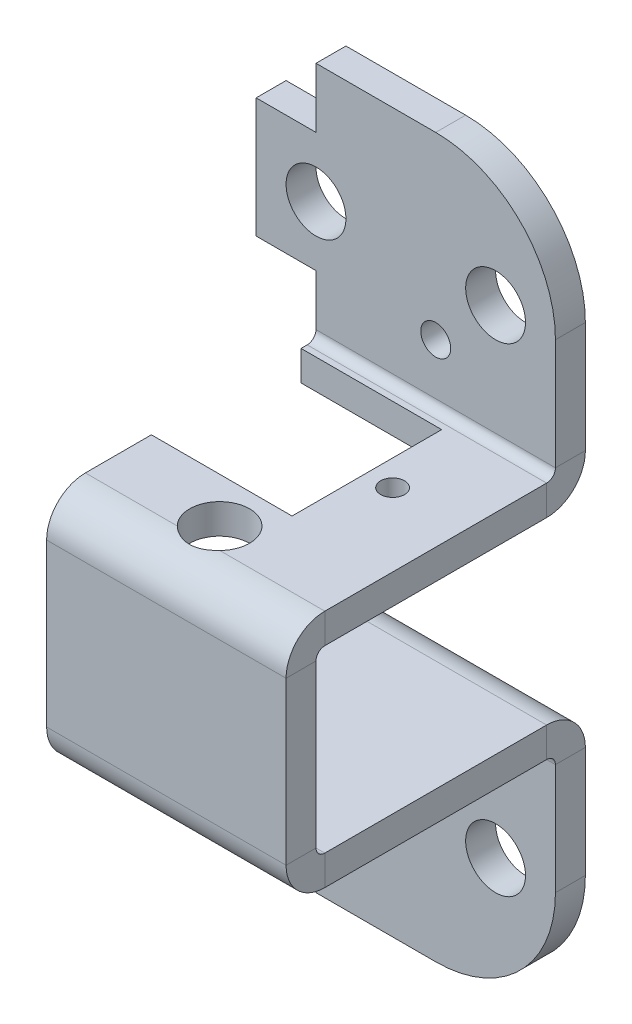
from build123d import *

# Parameters (mm, degrees)
SKETCH1_W           = 40
SKETCH1_H           = 60
SKETCH1_R           = 1.25
BASE_FLANGE1_DEPTH  = 2.5
SKETCH15_R          = 1
CUT_EXTRUDE3_DEPTH  = 10
JOG3_START          = -2.5
JOG3_OUTLINE_W      = 40
JOG3_OUTLINE_H      = 58.294687966
JOG3_OUTLINE_R      = 1
JOG3_OUTLINE_R_2    = 1.25
JOG3_DEPTH          = 2.5
JOG3_2_OUTLINE_W    = 40
JOG3_2_OUTLINE_H    = 1.705312034
JOG3_2_DEPTH        = 0.332528284
JOG3_START_2        = 19.2634
JOG3_3_OUTLINE_W    = 40
JOG3_3_OUTLINE_H    = 40
JOG3_3_OUTLINE_R    = 1
JOG3_3_OUTLINE_R_2  = 1.25
JOG3_3_DEPTH        = 3.2366
JOG3_4_OUTLINE_W    = 40
JOG3_4_OUTLINE_H    = 20.794687966
JOG3_4_OUTLINE_R    = 1.25
JOG3_4_DEPTH        = 3.2366
JOG3_5_OUTLINE_W    = 40
JOG3_5_OUTLINE_H    = 2.5
JOG3_5_DEPTH        = 20
JOG3_START_3        = 20
JOG3_6_OUTLINE_R    = 1.25
JOG3_6_OUTLINE_R_2  = 1
JOG3_6_DEPTH        = 2.5
JOG3_START_4        = -20
JOG3_7_DEPTH        = 40
JOG4_START          = -20
JOG4_DEPTH          = 40
JOG4_2_DEPTH        = 40
JOG4_START_2        = -3
JOG4_3_OUTLINE_R    = 1.25
JOG4_3_DEPTH        = 4
FILLET1_R           = 10
SKETCH18_R          = 2.5
BOSS_EXTRUDE1_DEPTH = 2.5
SKETCH19_R          = 1
SKETCH19_W          = 23.5
SKETCH19_H          = 12.5
CUT_EXTRUDE4_DEPTH  = 2.5
SKETCH20_R          = 2.5
CUT_EXTRUDE6_DEPTH  = 10
SKETCH23_R          = 2.5
CUT_EXTRUDE7_DEPTH  = 51.062460986
SKETCH24_R          = 5
CUT_EXTRUDE8_DEPTH  = 1.25
SKETCH26_R          = 2.5
CUT_EXTRUDE12_DEPTH = 51.062460987
SKETCH27_W          = 20
SKETCH27_H          = 13.5268
CUT_EXTRUDE13_DEPTH = 61.042487703


with BuildPart() as part:
    # Base-Flange1: sheet metal written as solids
    # Sketch1 → Base-Flange1 (new body)
    with BuildSketch(Plane.XY):
        Rectangle(SKETCH1_W, SKETCH1_H)
        with Locations((10, 15)):
            Circle(SKETCH1_R, mode=Mode.SUBTRACT)
        with Locations(Location((10, -15, 0), (0, 0, 180))):
            Circle(SKETCH1_R, mode=Mode.SUBTRACT)
        with Locations((-10, -15)):
            Circle(SKETCH1_R, mode=Mode.SUBTRACT)
        with Locations(Location((-10, 15, 0), (0, 0, 180))):
            Circle(SKETCH1_R, mode=Mode.SUBTRACT)
    extrude(amount=-BASE_FLANGE1_DEPTH)

    # Sketch15 → Cut-Extrude3 (cut)
    with BuildSketch(Plane.XY):
        with Locations((12, 0)):
            Circle(SKETCH15_R)
        with Locations(Location((-17, 0, 0), (0, 0, 180))):
            Circle(SKETCH15_R)
    extrude(amount=-CUT_EXTRUDE3_DEPTH, mode=Mode.SUBTRACT)

    # Jog3: read off the stored shape, not the designer's step
    # Jog3 outline → Jog3 (cut)
    with BuildSketch(Plane.XY.offset(JOG3_START)):
        with Locations((0, -0.852656017)):
            Rectangle(JOG3_OUTLINE_W, JOG3_OUTLINE_H)
        with Locations((-17, 0)):
            Circle(JOG3_OUTLINE_R, mode=Mode.SUBTRACT)
        with Locations((12, 0)):
            Circle(JOG3_OUTLINE_R, mode=Mode.SUBTRACT)
        with Locations((-10, 15)):
            Circle(JOG3_OUTLINE_R_2, mode=Mode.SUBTRACT)
        with Locations((10, 15)):
            Circle(JOG3_OUTLINE_R_2, mode=Mode.SUBTRACT)
        with Locations((10, -15)):
            Circle(JOG3_OUTLINE_R_2, mode=Mode.SUBTRACT)
        with Locations((-10, -15)):
            Circle(JOG3_OUTLINE_R_2, mode=Mode.SUBTRACT)
    extrude(amount=JOG3_DEPTH, mode=Mode.SUBTRACT)

    # Jog3 2 outline → Jog3 2 (cut)
    with BuildSketch(Plane.XY.offset(JOG3_START)):
        with Locations((0, 29.147343983)):
            Rectangle(JOG3_2_OUTLINE_W, JOG3_2_OUTLINE_H)
    extrude(amount=JOG3_2_DEPTH, mode=Mode.SUBTRACT)

    # Jog3 4 outline → Jog3 4 (add)
    with BuildSketch(Plane.XY.offset(JOG3_START)):
        with Locations((0, 40.397343983)):
            Rectangle(JOG3_4_OUTLINE_W, JOG3_4_OUTLINE_H)
        with Locations((10, 35.794687966)):
            Circle(JOG3_4_OUTLINE_R, mode=Mode.SUBTRACT)
        with Locations((-10, 35.794687966)):
            Circle(JOG3_4_OUTLINE_R, mode=Mode.SUBTRACT)
    extrude(amount=JOG3_4_DEPTH)



with BuildPart() as body_2:
    # Jog3 3 outline → Jog3 3 (new body)
    with BuildSketch(Plane.XY.offset(JOG3_START_2)):
        with Locations((0, 10.794687966)):
            Rectangle(JOG3_3_OUTLINE_W, JOG3_3_OUTLINE_H)
        with Locations((12, 20.794687966)):
            Circle(JOG3_3_OUTLINE_R, mode=Mode.SUBTRACT)
        with Locations((-17, 0)):
            Circle(JOG3_3_OUTLINE_R, mode=Mode.SUBTRACT)
        with Locations((-10, 5.794687966)):
            Circle(JOG3_3_OUTLINE_R_2, mode=Mode.SUBTRACT)
        with Locations((12, 0)):
            Circle(JOG3_3_OUTLINE_R, mode=Mode.SUBTRACT)
        with Locations((10, 5.794687966)):
            Circle(JOG3_3_OUTLINE_R_2, mode=Mode.SUBTRACT)
        with Locations((-17, 20.794687966)):
            Circle(JOG3_3_OUTLINE_R, mode=Mode.SUBTRACT)
        with Locations((-10, 15)):
            Circle(JOG3_3_OUTLINE_R_2, mode=Mode.SUBTRACT)
        with Locations((10, 15)):
            Circle(JOG3_3_OUTLINE_R_2, mode=Mode.SUBTRACT)
    extrude(amount=JOG3_3_DEPTH)


with BuildPart() as part_1:
    add(part.part)

    add(body_2.part)  # Jog3 5 merges body 2
    # Jog3 5 outline → Jog3 5 (add)
    with BuildSketch(Plane.XY):
        with Locations((0, 29.544687966)):
            Rectangle(JOG3_5_OUTLINE_W, JOG3_5_OUTLINE_H)
    extrude(amount=JOG3_5_DEPTH)

    # Jog3 6 outline → Jog3 6 (add)
    with BuildSketch(Plane.XY.offset(JOG3_START_3)):
        with Locations((10, 15)):
            Circle(JOG3_6_OUTLINE_R)
        with Locations((-10, 15)):
            Circle(JOG3_6_OUTLINE_R)
        with Locations((12, 0)):
            Circle(JOG3_6_OUTLINE_R_2)
        with Locations((-17, 0)):
            Circle(JOG3_6_OUTLINE_R_2)
    extrude(amount=JOG3_6_DEPTH)

    # Jog3 7 outline → Jog3 7 (cut)
    with BuildSketch(Plane.YZ.offset(JOG3_START_4)):
        with BuildLine():
            ThreePointArc((28.294687966, 19.2634), (28.078942821, 19.784254855), (27.558087966, 20))
            Line((27.558087966, 20), (-9.205312034, 20))
            Line((-9.205312034, 20), (-9.205312034, 19.2634))
            Line((-9.205312034, 19.2634), (28.294687966, 19.2634))
        make_face()
        with BuildLine():
            ThreePointArc((31.531287966, -2.5), (29.242666158, -1.552021808), (28.294687966, 0.7366))
            Line((28.294687966, 0.7366), (28.294687966, -2.167471716))
            Line((28.294687966, -2.167471716), (30, -2.167471716))
            Line((30, -2.167471716), (30, -2.5))
            Line((30, -2.5), (31.531287966, -2.5))
        make_face()
        with BuildLine():
            Line((31.531287966, 0), (50.794687966, 0))
            Line((50.794687966, 0), (50.794687966, 0.7366))
            Line((50.794687966, 0.7366), (30.794687966, 0.7366))
            ThreePointArc((30.794687966, 0.7366), (31.010433111, 0.215745145), (31.531287966, 0))
        make_face()
        with BuildLine():
            Line((30.794687966, 22.5), (27.558087966, 22.5))
            ThreePointArc((27.558087966, 22.5), (29.846709774, 21.552021808), (30.794687966, 19.2634))
            Line((30.794687966, 19.2634), (30.794687966, 22.5))
        make_face()
    extrude(amount=JOG3_7_DEPTH, mode=Mode.SUBTRACT)

    # Jog4: read off the stored shape, not the designer's step
    # Jog4 outline → Jog4 (cut)
    with BuildSketch(Plane.YZ.offset(JOG4_START)):
        with BuildLine():
            Line((-9.205312034, 20), (10.87962174, 20))
            ThreePointArc((10.87962174, 20), (12.019882984, 21.799110859), (14.031287966, 22.5))
            Line((14.031287966, 22.5), (-9.205312034, 22.5))
            Line((-9.205312034, 22.5), (-9.205312034, 20))
        make_face()
    extrude(amount=JOG4_DEPTH, mode=Mode.SUBTRACT)

    # Jog4 2 outline → Jog4 2 (add)
    with BuildSketch(Plane.YZ.offset(JOG4_START)):
        with BuildLine():
            Line((-9.205312034, 0), (-9.205312034, -2.5))
            Line((-9.205312034, -2.5), (10.058087966, -2.5))
            ThreePointArc((10.058087966, -2.5), (12.346709774, -1.552021808), (13.294687966, 0.7366))
            Line((13.294687966, 0.7366), (13.294687966, 19.2634))
            ThreePointArc((13.294687966, 19.2634), (13.510433111, 19.784254855), (14.031287966, 20))
            Line((14.031287966, 20), (10.87962174, 20))
            ThreePointArc((10.87962174, 20), (10.81599152, 19.634140241), (10.794687966, 19.2634))
            Line((10.794687966, 19.2634), (10.794687966, 0.7366))
            ThreePointArc((10.794687966, 0.7366), (10.578942821, 0.215745145), (10.058087966, 0))
            Line((10.058087966, 0), (-9.205312034, 0))
        make_face()
    extrude(amount=JOG4_2_DEPTH)

    # Jog4 3 outline → Jog4 3 (cut)
    with BuildSketch(Plane.XY.offset(JOG4_START_2)):
        with Locations((-10, 5.794687966)):
            Circle(JOG4_3_OUTLINE_R)
        with Locations((10, 5.794687966)):
            Circle(JOG4_3_OUTLINE_R)
    extrude(amount=JOG4_3_DEPTH, mode=Mode.SUBTRACT)

    # Fillet1
    fillet1_edges = [part_1.edges().sort_by_distance(p)[0] for p in [
        (20, -9.205312034, -1.25),
        (-20, -9.205312034, -1.25),
        (-20, 50.794687966, -1.25),
        (20, 50.794687966, -1.25),
    ]]
    fillet(fillet1_edges, radius=FILLET1_R)

    # Sketch18 → Boss-Extrude1 (add)
    with BuildSketch(Plane.XY.offset(22.5)):
        with Locations((12, 20.794687966)):
            Circle(SKETCH18_R)
        with Locations((-17, 20.794687966)):
            Circle(SKETCH18_R)
    extrude(amount=-BOSS_EXTRUDE1_DEPTH)

    # Sketch19 → Cut-Extrude4 (cut)
    with BuildSketch(Plane(origin=(0, 30.794687966, 0), x_dir=(1, 0, 0), z_dir=(0, 1, 0))):
        with Locations(Location((13.9, -7.5, 0), (0, 0, 270))):
            Circle(SKETCH19_R)
        with Locations(Location((-13.9, -7.5, 0), (0, 0, 90))):
            Circle(SKETCH19_R)
        with Locations((0, -7.5)):
            Rectangle(SKETCH19_W, SKETCH19_H)
    extrude(amount=-CUT_EXTRUDE4_DEPTH, mode=Mode.SUBTRACT)

    # Sketch20 → Cut-Extrude6 (cut)
    with BuildSketch(Plane.XY):
        with Locations((0, 40.794687966)):
            Circle(SKETCH20_R)
        with Locations(Location((0, 0.794687966, 0), (0, 0, 180))):
            Circle(SKETCH20_R)
        with Locations((15, 0.794687966)):
            Circle(SKETCH20_R)
        with Locations(Location((-15, 0.794687966, 0), (0, 0, 180))):
            Circle(SKETCH20_R)
        with Locations(Location((15, 40.794687966, 0), (0, 0, 180))):
            Circle(SKETCH20_R)
        with Locations((-15, 40.794687966)):
            Circle(SKETCH20_R)
    extrude(amount=-CUT_EXTRUDE6_DEPTH, mode=Mode.SUBTRACT)

    # Sketch23 → Cut-Extrude7 (cut, through all)
    with BuildSketch(Plane(origin=(0, 30.794687966, 0), x_dir=(1, 0, 0), z_dir=(0, 1, 0))):
        with Locations(Location((-5.55, -7.5, 0), (0, 0, 270))):
            Circle(SKETCH23_R)
    extrude(amount=-CUT_EXTRUDE7_DEPTH, mode=Mode.SUBTRACT)

    # Sketch24 → Cut-Extrude8 (cut)
    with BuildSketch(Plane(origin=(0, 13.294687966, 0), x_dir=(1, 0, 0), z_dir=(0, 1, 0))):
        with Locations(Location((-5.55, -7.5, 0), (0, 0, 270))):
            Circle(SKETCH24_R)
    extrude(amount=-CUT_EXTRUDE8_DEPTH, mode=Mode.SUBTRACT)

    # Sketch26 → Cut-Extrude12 (cut, through all)
    with BuildSketch(Plane.XZ.offset(-10.794687966)):
        with Locations(Location((9.45, 17.5, 0), (0, 0, 135.141364755))):
            Circle(SKETCH26_R)
    extrude(amount=-CUT_EXTRUDE12_DEPTH, mode=Mode.SUBTRACT)

    # Sketch27 → Cut-Extrude13 (cut, through all)
    with BuildSketch(Plane.XY.offset(22.5)):
        with Locations((-10, 20.794687966)):
            Rectangle(SKETCH27_W, SKETCH27_H)
        Polygon((0, 45.794687966), (0, 50.794687966), (-20, 50.794687966), (-20, 27.558087966), (0, 27.558087966), (0, 35.794687966), (-5, 35.794687966), (-5, 45.794687966), align=None)
        Polygon((0, 14.031287966), (-20, 14.031287966), (-20, -9.205312034), (0, -9.205312034), (0, -4.205312034), (5, -4.205312034), (5, 5.794687966), (0, 5.794687966), align=None)
    extrude(amount=-CUT_EXTRUDE13_DEPTH, mode=Mode.SUBTRACT)


solid = part_1.part
